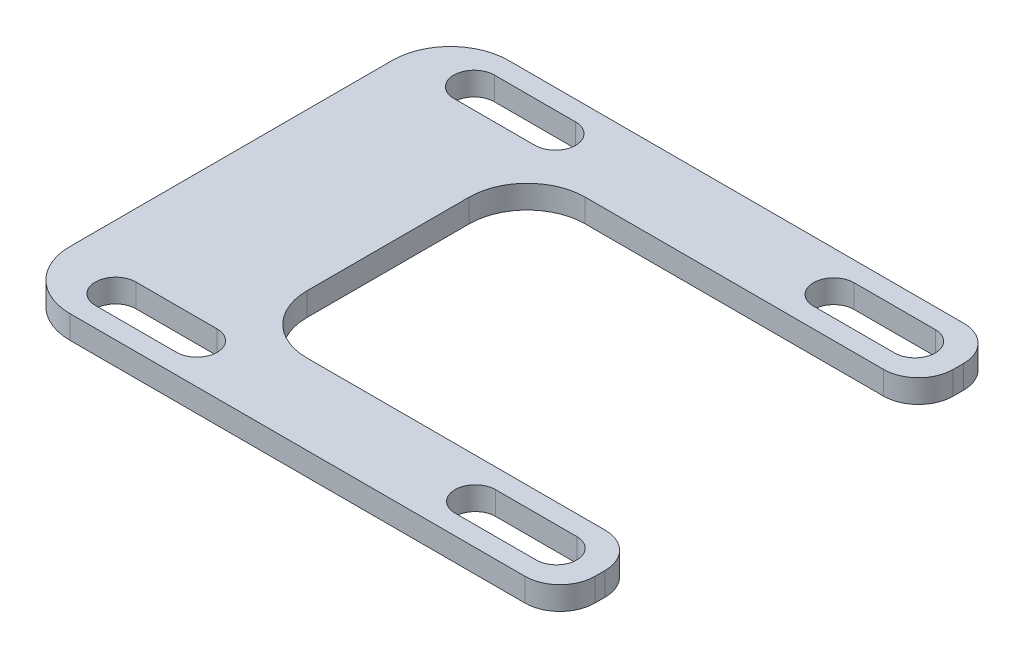
from build123d import *

# Parameters (mm, degrees)
BOSS_EXTRUDE1_DEPTH = 2
FILLET1_R           = 5
FILLET2_R           = 3


with BuildPart() as part:
    # Sketch1 → Boss-Extrude1 (new body)
    with BuildSketch(Plane(origin=(0, 0, 0), x_dir=(1, 0, 0), z_dir=(0, 1, 0))):
        Polygon((47.24332582, 30.9), (47.24332582, 37.8), (0, 37.8), (0, 0), (47.24332582, 0), (47.24332582, 6.9), (13.518849419, 6.9), (13.518849419, 30.9), align=None)
        with BuildLine():
            Line((5.49332582, 36.1), (12.49332582, 36.1))
            ThreePointArc((12.49332582, 36.1), (14.24332582, 34.35), (12.49332582, 32.6))
            Line((12.49332582, 32.6), (5.49332582, 32.6))
            ThreePointArc((5.49332582, 32.6), (3.74332582, 34.35), (5.49332582, 36.1))
        make_face(mode=Mode.SUBTRACT)
        with BuildLine():
            Line((36.49332582, 36.1), (43.49332582, 36.1))
            ThreePointArc((43.49332582, 36.1), (45.24332582, 34.35), (43.49332582, 32.6))
            Line((43.49332582, 32.6), (36.49332582, 32.6))
            ThreePointArc((36.49332582, 32.6), (34.74332582, 34.35), (36.49332582, 36.1))
        make_face(mode=Mode.SUBTRACT)
        with BuildLine():
            Line((5.49332582, 5.2), (12.49332582, 5.2))
            ThreePointArc((12.49332582, 5.2), (14.24332582, 3.45), (12.49332582, 1.7))
            Line((12.49332582, 1.7), (5.49332582, 1.7))
            ThreePointArc((5.49332582, 1.7), (3.74332582, 3.45), (5.49332582, 5.2))
        make_face(mode=Mode.SUBTRACT)
        with BuildLine():
            Line((36.49332582, 5.2), (43.49332582, 5.2))
            ThreePointArc((43.49332582, 5.2), (45.24332582, 3.45), (43.49332582, 1.7))
            Line((43.49332582, 1.7), (36.49332582, 1.7))
            ThreePointArc((36.49332582, 1.7), (34.74332582, 3.45), (36.49332582, 5.2))
        make_face(mode=Mode.SUBTRACT)
    extrude(amount=BOSS_EXTRUDE1_DEPTH)

    # Fillet1
    fillet1_edges = [part.edges().sort_by_distance(p)[0] for p in [
        (0, 1, -37.8),
        (0, 1, 0),
        (13.518849419, 1, -6.9),
        (13.518849419, 1, -30.9),
    ]]
    fillet(fillet1_edges, radius=FILLET1_R)

    # Fillet2
    fillet2_edges = [part.edges().sort_by_distance(p)[0] for p in [
        (47.24332582, 1, -6.9),
        (47.24332582, 1, 0),
        (47.24332582, 1, -30.9),
        (47.24332582, 1, -37.8),
    ]]
    fillet(fillet2_edges, radius=FILLET2_R)


solid = part.part
